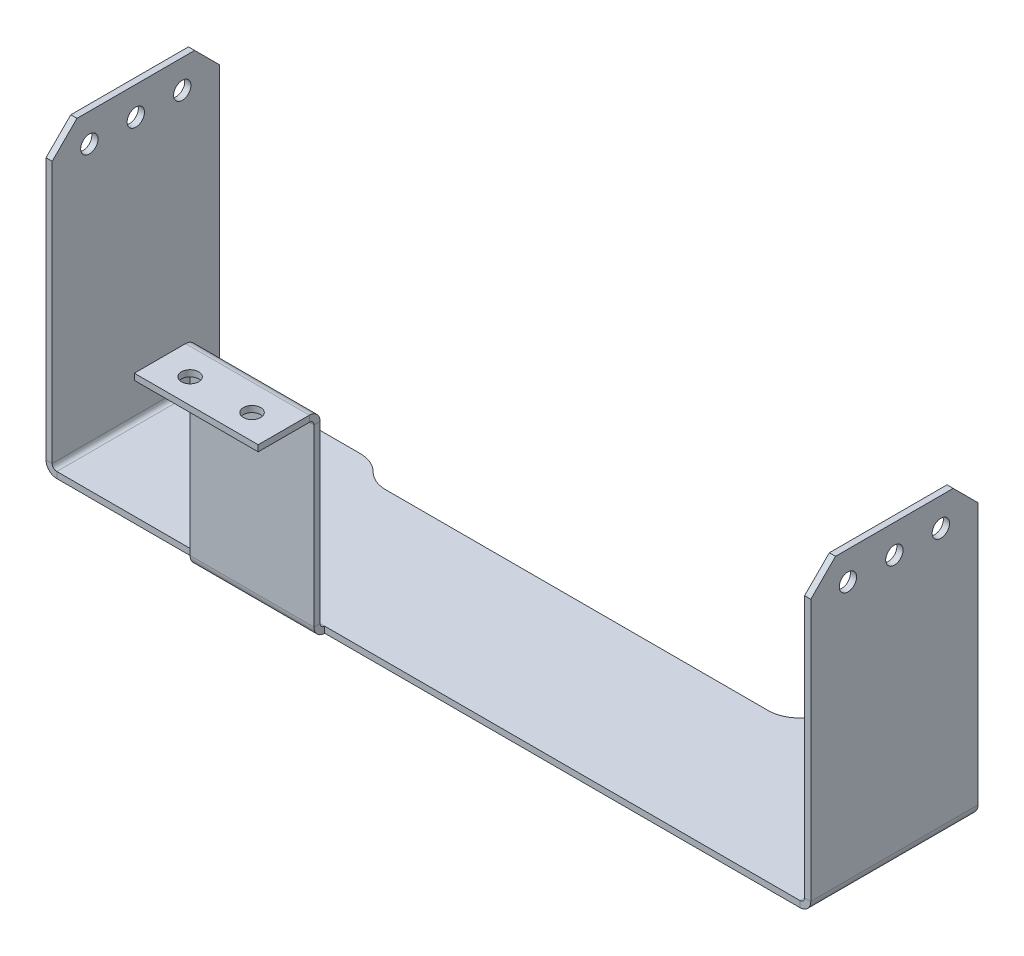
from build123d import *

# Parameters (mm, degrees)
SKETCH6_W               = 120
SKETCH6_H               = 27
BASE_FLANGE2_DEPTH      = 1
EDGE_FLANGE1_DEPTH      = 27
EDGE_FLANGE1_BEND_DEPTH = 27
EDGE_FLANGE2_DEPTH      = 20
EDGE_FLANGE3_DEPTH      = 20
CUT_EXTRUDE1_REACH      = 136.321
SKETCH26_R              = 1.4
CUT_EXTRUDE2_REACH      = 75.526
SKETCH27_R              = 1.4
BREAK_CORNER1_START     = -61.7366
BREAK_CORNER1_DEPTH     = 123.4732
CUT_EXTRUDE3_REACH      = 83.289


# Read off the part's stored shape, not the designer's step: Break-Corner1
# Sheet-metal steps are written as plain solids
with BuildPart() as part:
    # Sketch6 → Base-Flange2 (new body)
    with BuildSketch(Plane(origin=(0, 0, 0), x_dir=(1, 0, 0), z_dir=(0, 1, 0))):
        Rectangle(SKETCH6_W, SKETCH6_H)
    extrude(amount=-BASE_FLANGE2_DEPTH)

    # Edge-Flange1 section (across the edge) → Edge-Flange1 (add)
    with BuildSketch(Plane(origin=(-60.7366, 0, -13.5), x_dir=(1, 0, 0), z_dir=(0, 0, 1))):
        with BuildLine():
            Line((-1, 0.7366), (-1, 47))
            Line((-1, 47), (0, 47))
            Line((0, 47), (0, 0.7366))
            ThreePointArc((0, 0.7366), (0.215745145, 0.215745145), (0.7366, 0))
            Line((0.7366, 0), (0.7366, -1))
            ThreePointArc((0.7366, -1), (-0.491361636, -0.491361636), (-1, 0.7366))
        make_face()
    extrude(amount=EDGE_FLANGE1_DEPTH)

    # Edge-Flange1 section 2 (across the edge) → Edge-Flange1 bend (add)
    with BuildSketch(Plane(origin=(60.7366, 0, 13.5), x_dir=(-1, 0, 0), z_dir=(0, 0, -1))):
        with BuildLine():
            Line((-1, 0.7366), (-1, 47))
            Line((-1, 47), (0, 47))
            Line((0, 47), (0, 0.7366))
            ThreePointArc((0, 0.7366), (0.215745145, 0.215745145), (0.7366, 0))
            Line((0.7366, 0), (0.7366, -1))
            ThreePointArc((0.7366, -1), (-0.491361636, -0.491361636), (-1, 0.7366))
        make_face()
    extrude(amount=EDGE_FLANGE1_BEND_DEPTH)

    # Edge-Flange2 section (across the edge) → Edge-Flange2 (add)
    with BuildSketch(Plane(origin=(-36.7366, 0, 14.2366), x_dir=(0, 0, -1), z_dir=(1, 0, 0))):
        with BuildLine():
            Line((-1, 0.7366), (-1, 29))
            Line((-1, 29), (0, 29))
            Line((0, 29), (0, 0.7366))
            ThreePointArc((0, 0.7366), (0.215745145, 0.215745145), (0.7366, 0))
            Line((0.7366, 0), (0.7366, -1))
            ThreePointArc((0.7366, -1), (-0.491361636, -0.491361636), (-1, 0.7366))
        make_face()
    extrude(amount=EDGE_FLANGE2_DEPTH)

    # Edge-Flange3 section (across the edge) → Edge-Flange3 (add)
    with BuildSketch(Plane(origin=(-16.7366, 29.7366, 15.2366), x_dir=(0, -1, 0), z_dir=(-1, 0, 0))):
        with BuildLine():
            Line((-1, 0.7366), (-1, 9))
            Line((-1, 9), (0, 9))
            Line((0, 9), (0, 0.7366))
            ThreePointArc((0, 0.7366), (0.215745145, 0.215745145), (0.7366, 0))
            Line((0.7366, 0), (0.7366, -1))
            ThreePointArc((0.7366, -1), (-0.491361636, -0.491361636), (-1, 0.7366))
        make_face()
    extrude(amount=EDGE_FLANGE3_DEPTH)

    # Sketch26 → Cut-Extrude1 (cut, up to next)
    with BuildSketch(Plane(origin=(61.7366, 0, 0), x_dir=(0, 0, -1), z_dir=(1, 0, 0)), mode=Mode.PRIVATE) as cut_extrude1_sk1:
        with Locations(Location((-7.5, 42.419132502, 0), (0, 0, 90))):
            Circle(SKETCH26_R)
    cut_extrude1_tool1 = extrude(cut_extrude1_sk1.sketch, amount=-CUT_EXTRUDE1_REACH, mode=Mode.PRIVATE) & part.part
    # Sketch26 → Cut-Extrude1 (cut, up to next)
    with BuildSketch(Plane(origin=(61.7366, 0, 0), x_dir=(0, 0, -1), z_dir=(1, 0, 0)), mode=Mode.PRIVATE) as cut_extrude1_sk2:
        with Locations(Location((0, 42.419132502, 0), (0, 0, 90))):
            Circle(SKETCH26_R)
    cut_extrude1_tool2 = extrude(cut_extrude1_sk2.sketch, amount=-CUT_EXTRUDE1_REACH, mode=Mode.PRIVATE) & part.part
    # Sketch26 → Cut-Extrude1 (cut, up to next)
    with BuildSketch(Plane(origin=(61.7366, 0, 0), x_dir=(0, 0, -1), z_dir=(1, 0, 0)), mode=Mode.PRIVATE) as cut_extrude1_sk3:
        with Locations(Location((7.5, 42.419132502, 0), (0, 0, 90))):
            Circle(SKETCH26_R)
    cut_extrude1_tool3 = extrude(cut_extrude1_sk3.sketch, amount=-CUT_EXTRUDE1_REACH, mode=Mode.PRIVATE) & part.part
    cut_extrude1_1 = cut_extrude1_tool1.solids().sort_by_distance((61.7366, 42.419133, 7.5))[0]
    add(cut_extrude1_1, mode=Mode.SUBTRACT)
    cut_extrude1_2 = cut_extrude1_tool2.solids().sort_by_distance((61.7366, 42.419133, 0))[0]
    add(cut_extrude1_2, mode=Mode.SUBTRACT)
    cut_extrude1_3 = cut_extrude1_tool3.solids().sort_by_distance((61.7366, 42.419133, -7.5))[0]
    add(cut_extrude1_3, mode=Mode.SUBTRACT)
    cut_extrude1 = cut_extrude1_1 + cut_extrude1_2 + cut_extrude1_3  # Cut-Extrude1 as one shape, for the pattern or mirror that repeats it

    # Mirror1: Cut-Extrude1 across plane
    add(cut_extrude1.mirror(Plane(origin=(0, 0, 0), x_dir=(0, 0, 1), z_dir=(1, 0, 0))), mode=Mode.SUBTRACT)

    # Sketch27 → Cut-Extrude2 (cut, up to next)
    with BuildSketch(Plane(origin=(0, 30.7366, 0), x_dir=(1, 0, 0), z_dir=(0, 1, 0)), mode=Mode.PRIVATE) as cut_extrude2_sk1:
        with Locations(Location((-31.7366, -20.2366, 0), (0, 0, 270))):
            Circle(SKETCH27_R)
    cut_extrude2_tool1 = extrude(cut_extrude2_sk1.sketch, amount=-CUT_EXTRUDE2_REACH, mode=Mode.PRIVATE) & part.part
    # Sketch27 → Cut-Extrude2 (cut, up to next)
    with BuildSketch(Plane(origin=(0, 30.7366, 0), x_dir=(1, 0, 0), z_dir=(0, 1, 0)), mode=Mode.PRIVATE) as cut_extrude2_sk2:
        with Locations(Location((-21.7366, -20.2366, 0), (0, 0, 270))):
            Circle(SKETCH27_R)
    cut_extrude2_tool2 = extrude(cut_extrude2_sk2.sketch, amount=-CUT_EXTRUDE2_REACH, mode=Mode.PRIVATE) & part.part
    add(cut_extrude2_tool1.solids().sort_by_distance((-31.7366, 30.7366, 20.2366))[0], mode=Mode.SUBTRACT)
    add(cut_extrude2_tool2.solids().sort_by_distance((-21.7366, 30.7366, 20.2366))[0], mode=Mode.SUBTRACT)

    # Break-Corner1 outline → Break-Corner1 (cut)
    with BuildSketch(Plane.YZ.offset(BREAK_CORNER1_START)):
        Polygon((47, -13.5), (47, -9.5), (43, -13.5), align=None)
        Polygon((43, 13.5), (47, 9.5), (47, 13.5), align=None)
    extrude(amount=BREAK_CORNER1_DEPTH, mode=Mode.SUBTRACT)

    # Sketch29 → Cut-Extrude3 (cut, up to next)
    with BuildSketch(Plane(origin=(0, 0, 0), x_dir=(1, 0, 0), z_dir=(0, 1, 0)), mode=Mode.PRIVATE) as cut_extrude3_sk1:
        with BuildLine():
            Line((-34.494615607, 12.065428481), (-34.361517182, 11.934571519))
            ThreePointArc((-34.361517182, 11.934571519), (-32.749919682, 10.872519994), (-30.856132789, 10.5))
            Line((-30.856132789, 10.5), (30.858555604, 10.5))
            ThreePointArc((30.858555604, 10.5), (32.791568542, 10.888767954), (34.423984085, 11.994615607))
            Line((34.423984085, 11.994615607), (34.434571519, 12.005384393))
            ThreePointArc((34.434571519, 12.005384393), (36.066987062, 13.111232046), (38, 13.5))
            Line((38, 13.5), (-38, 13.5))
            ThreePointArc((-38, 13.5), (-36.106213107, 13.127480006), (-34.494615607, 12.065428481))
        make_face()
    cut_extrude3_tool1 = extrude(cut_extrude3_sk1.sketch, amount=-CUT_EXTRUDE3_REACH, mode=Mode.PRIVATE) & part.part
    add(cut_extrude3_tool1.solids().sort_by_distance((0.000586, 0, -12.034279))[0], mode=Mode.SUBTRACT)


solid = part.part
